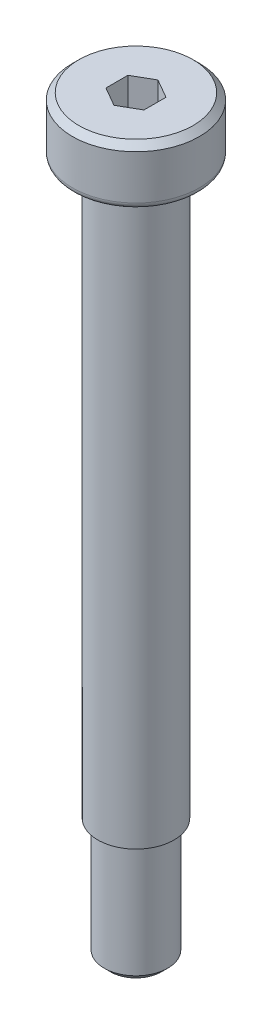
from build123d import *

# Parameters (mm, degrees)
CUT_EXTRUDE1_DEPTH = 2.4
CHAMFER1_SIZE      = 0.5
FILLET1_R          = 0.5
CHAMFER2_SIZE      = 0.5


with BuildPart() as part:
    # Sketch1 → Revolve1 (revolve)
    with BuildSketch(Plane.XY):
        Polygon((0, 0), (5, 0), (5, -4.5), (2.75, -4.5), (2.75, -5), (3, -5), (3, -49.5), (2.5, -49.5), (2.5, -59), (0, -59), align=None)
    revolve(axis=Axis((0, 5, 0), (0, -1, 0)))

    # Sketch2 → Cut-Extrude1 (cut)
    with BuildSketch(Plane(origin=(0, 0, 0), x_dir=(1, 0, 0), z_dir=(0, 1, 0))):
        Polygon((0, -1.732050808), (1.5, -0.866025404), (1.5, 0.866025404), (0, 1.732050808), (-1.5, 0.866025404), (-1.5, -0.866025404), align=None)
    extrude(amount=-CUT_EXTRUDE1_DEPTH, mode=Mode.SUBTRACT)

    # Chamfer1
    chamfer1_edges = [part.edges().sort_by_distance(p)[0] for p in [
        (-5, 0, 0),
    ]]
    chamfer(chamfer1_edges, length=CHAMFER1_SIZE)

    # Fillet1
    fillet1_edges = [part.edges().sort_by_distance(p)[0] for p in [
        (-5, -4.5, 0),
    ]]
    fillet(fillet1_edges, radius=FILLET1_R)

    # Chamfer2
    chamfer2_edges = [part.edges().sort_by_distance(p)[0] for p in [
        (-2.5, -59, 0),
    ]]
    chamfer(chamfer2_edges, length=CHAMFER2_SIZE)


solid = part.part
